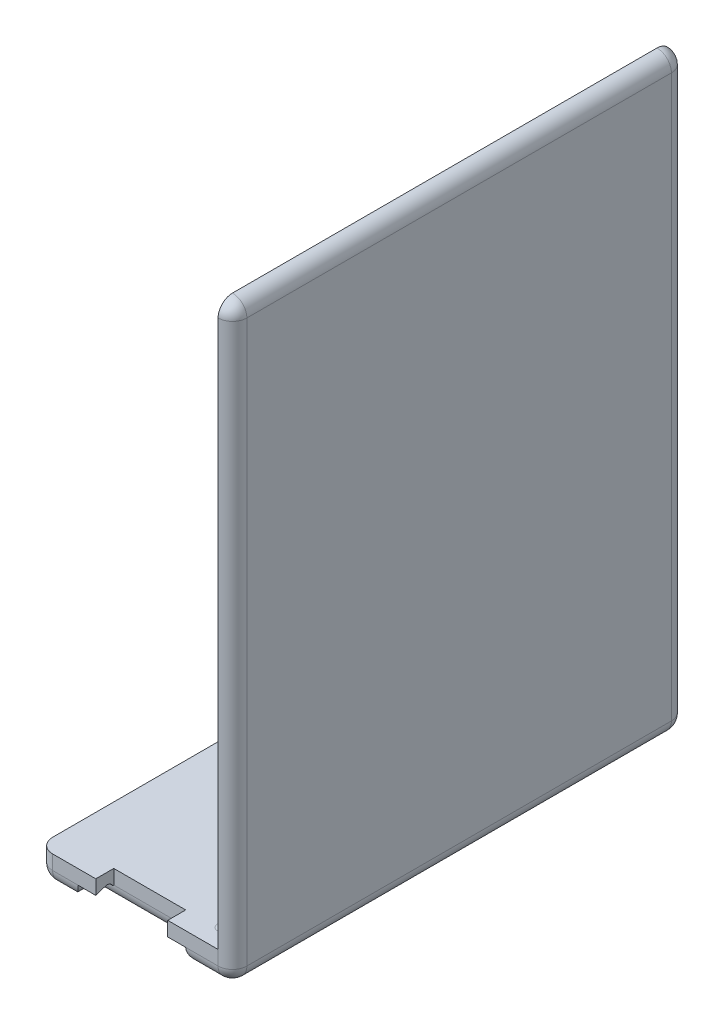
from build123d import *

# Parameters (mm, degrees)
SKETCH1_W           = 25
SKETCH1_H           = 63
BOSS_EXTRUDE1_DEPTH = 4
SKETCH3_W           = 63
SKETCH3_H           = 4
BOSS_EXTRUDE2_DEPTH = 2
SKETCH4_W           = 2
SKETCH4_H           = 63
BOSS_EXTRUDE3_DEPTH = 78
SKETCH6_W           = 10
SKETCH6_H           = 2.5
CUT_EXTRUDE1_DEPTH  = 107.386089316
SKETCH6_3_W         = 10
SKETCH6_3_H         = 2.5
CUT_EXTRUDE2_DEPTH  = 80
SKETCH8_W           = 15
SKETCH8_H           = 2
CUT_EXTRUDE3_DEPTH  = 2.5
CUT_EXTRUDE5_DEPTH  = 15
SKETCH11_W          = 15
SKETCH11_H          = 2
CUT_EXTRUDE6_DEPTH  = 3
CUT_EXTRUDE7_DEPTH  = 15
FILLET6_R           = 2
FILLET7_R           = 2
BOSS_EXTRUDE4_DEPTH = 73
FILLET8_R           = 0.4
FILLET9_R           = 2
CUT_EXTRUDE8_DEPTH  = 2


# Some blends are built 0.0001 mm under size
with BuildPart() as part:
    # Sketch1 → Boss-Extrude1 (new body)
    with BuildSketch(Plane(origin=(0, 0, 0), x_dir=(1, 0, 0), z_dir=(0, 1, 0))):
        with Locations((-12.5, -31.5)):
            Rectangle(SKETCH1_W, SKETCH1_H)
    extrude(amount=BOSS_EXTRUDE1_DEPTH)

    # Sketch3 → Boss-Extrude2 (add)
    with BuildSketch(Plane(origin=(0, 0, 0), x_dir=(0, 0, -1), z_dir=(1, 0, 0))):
        with Locations((-31.5, 2)):
            Rectangle(SKETCH3_W, SKETCH3_H)
    extrude(amount=BOSS_EXTRUDE2_DEPTH)

    # Sketch4 → Boss-Extrude3 (add)
    with BuildSketch(Plane(origin=(0, 4, 0), x_dir=(1, 0, 0), z_dir=(0, 1, 0))):
        with Locations((1, -31.5)):
            Rectangle(SKETCH4_W, SKETCH4_H)
    extrude(amount=BOSS_EXTRUDE3_DEPTH)

    # Sketch6 → Cut-Extrude1 (cut, through all)
    with BuildSketch(Plane.XZ):
        with Locations((-12, 1.25)):
            Rectangle(SKETCH6_W, SKETCH6_H)
    extrude(amount=-CUT_EXTRUDE1_DEPTH, mode=Mode.SUBTRACT)

    # Sketch6<3> → Cut-Extrude2 (cut)
    with BuildSketch(Plane.XZ):
        with Locations((-12, 61.75)):
            Rectangle(SKETCH6_3_W, SKETCH6_3_H)
    extrude(amount=-CUT_EXTRUDE2_DEPTH, mode=Mode.SUBTRACT)

    # Sketch8 → Cut-Extrude3 (cut)
    with BuildSketch(Plane.XY.offset(63)):
        with Locations((-12, 1)):
            Rectangle(SKETCH8_W, SKETCH8_H)
    extrude(amount=-CUT_EXTRUDE3_DEPTH, mode=Mode.SUBTRACT)

    # Sketch9 → Cut-Extrude5 (cut)
    with BuildSketch(Plane.ZY.offset(4.5)):
        with BuildLine():
            ThreePointArc((61.5, 2.5), (61, 2.366025404), (60.633974596, 2))
            Line((60.633974596, 2), (63, 2))
            Line((63, 2), (61.5, 2.5))
        make_face()
    extrude(amount=CUT_EXTRUDE5_DEPTH, mode=Mode.SUBTRACT)

    # Sketch11 → Cut-Extrude6 (cut)
    with BuildSketch(Plane(origin=(0, 0, 0), x_dir=(-1, 0, 0), z_dir=(0, 0, -1))):
        with Locations((12, 1)):
            Rectangle(SKETCH11_W, SKETCH11_H)
    extrude(amount=-CUT_EXTRUDE6_DEPTH, mode=Mode.SUBTRACT)

    # Sketch12 → Cut-Extrude7 (cut)
    with BuildSketch(Plane.ZY.offset(4.5)):
        with BuildLine():
            ThreePointArc((2.766025404, 2), (2.4, 2.366025404), (1.9, 2.5))
            Line((1.9, 2.5), (0, 2))
            Line((0, 2), (2.766025404, 2))
        make_face()
    extrude(amount=CUT_EXTRUDE7_DEPTH, mode=Mode.SUBTRACT)

    # Fillet6
    fillet6_edges = [part.edges().sort_by_distance(p)[0] for p in [
        (-22.25, 0, 0),
        (-12, 0, 3),
        (-19.5, 0, 1.5),
        (-4.5, 0, 1.5),
        (2, 0, 31.5),
        (-22.25, 0, 63),
        (-25, 0, 31.5),
        (-1.25, 0, 0),
        (-12, 0, 60.5),
        (-1.25, 0, 63),
        (-4.5, 0, 61.75),
        (-19.5, 0, 61.75),
    ]]
    fillet(fillet6_edges, radius=FILLET6_R - 0.0001)  # a hair under: the kernel refuses the full size

    # Fillet7
    # the kernel refuses this fillet: 2 mm, written as the material it takes off along each edge
    with BuildSketch(Plane(origin=(-23, 0, 61), x_dir=(0, 0, 1), z_dir=(1, 0, 0))) as fillet7_piece_1:
        with BuildLine():
            CenterArc((0.0001, -1.9999), 1.9999, 0, 90)
            Line((2, -1.9999), (2, 0))
            Line((2, 0), (0.0001, 0))
        make_face()
    revolve(axis=Axis((-23, 0, 61), (0, -1, 0)), revolution_arc=90, mode=Mode.SUBTRACT)
    with BuildSketch(Plane(origin=(-23, 0, 2), x_dir=(-1, 0, 0), z_dir=(0, 0, 1))) as fillet7_piece_2:
        with BuildLine():
            CenterArc((0.0001, -1.9999), 1.9999, 0, 90)
            Line((2, -1.9999), (2, 0))
            Line((2, 0), (0.0001, 0))
        make_face()
    revolve(axis=Axis((-23, 0, 2), (0, -1, 0)), revolution_arc=90, mode=Mode.SUBTRACT)
    with BuildSketch(Plane(origin=(-25, 0, 63), x_dir=(0, 0, -1), z_dir=(0, 1, 0)), Plane(origin=(-25, 0, 0), x_dir=(1, 0, 0), z_dir=(0, 1, 0))) as fillet7_piece_3:
        with BuildLine():
            CenterArc((FILLET7_R, -FILLET7_R), FILLET7_R, 90, 90)
            Line((0, -FILLET7_R), (0, 0))
            Line((0, 0), (FILLET7_R, 0))
        make_face()
    extrude(amount=9, mode=Mode.SUBTRACT)

    # Sketch13 → Boss-Extrude4 (add)
    with BuildSketch(Plane(origin=(0, 4, 0), x_dir=(1, 0, 0), z_dir=(0, 1, 0))):
        Polygon((0, -4.25), (-1.5, -4.25), (-1.5, -2.6), (-2.7, -2.6), (-2.7, -5.6), (0, -5.6), align=None)
        Polygon((-1.5, -60.4), (-2.7, -60.4), (-2.7, -57.4), (0, -57.4), (0, -58.75), (-1.5, -58.75), align=None)
    extrude(amount=BOSS_EXTRUDE4_DEPTH)

    # Fillet8
    fillet8_edges = [part.edges().sort_by_distance(p)[0] for p in [
        (0, 40.5, 5.6),
        (-1.5, 4, 3.425),
        (-2.1, 4, 2.6),
        (-1.5, 40.5, 2.6),
        (-2.7, 4, 4.1),
        (-2.7, 40.5, 2.6),
        (-1.35, 4, 5.6),
        (-2.7, 40.5, 5.6),
        (0, 77, 4.925),
        (-2.1, 77, 2.6),
        (-2.7, 77, 4.1),
        (-1.35, 77, 5.6),
        (-1.5, 4, 59.575),
        (-1.5, 40.5, 60.4),
        (-1.35, 4, 57.4),
        (0, 40.5, 57.4),
        (-2.7, 4, 58.9),
        (-2.7, 40.5, 57.4),
        (-2.1, 4, 60.4),
        (-2.7, 40.5, 60.4),
        (0, 77, 58.075),
        (-1.35, 77, 57.4),
        (-2.7, 77, 58.9),
        (-2.1, 77, 60.4),
    ]]
    fillet(fillet8_edges, radius=FILLET8_R)

    # Fillet9
    # the kernel refuses this fillet: 2 mm, written as the material it takes off along each edge
    with BuildSketch(Plane(origin=(0, 0, 61), x_dir=(1, 0, 0), z_dir=(0, 0, -1))) as fillet9_piece_1:
        with BuildLine():
            CenterArc((0.0001, -1.9999), 1.9999, 0, 90)
            Line((2, -1.9999), (2, 0))
            Line((2, 0), (0.0001, 0))
        make_face()
    revolve(axis=Axis((0, 0, 61), (0, -1, 0)), revolution_arc=90, mode=Mode.SUBTRACT)
    with BuildSketch(Plane(origin=(0, 0, 2), x_dir=(0, 0, -1), z_dir=(-1, 0, 0))) as fillet9_piece_2:
        with BuildLine():
            CenterArc((0.0001, -1.9999), 1.9999, 0, 90)
            Line((2, -1.9999), (2, 0))
            Line((2, 0), (0.0001, 0))
        make_face()
    revolve(axis=Axis((0, 0, 2), (0, -1, 0)), revolution_arc=90, mode=Mode.SUBTRACT)
    with BuildSketch(Plane(origin=(0, 80, 61), x_dir=(0, 0, 1), z_dir=(1, 0, 0))) as fillet9_piece_3_section:
        Polygon((0, 0), (FILLET9_R, 0), (FILLET9_R, -FILLET9_R), (0, -FILLET9_R), align=None)
    fillet9_piece_3 = extrude(amount=FILLET9_R, mode=Mode.PRIVATE)
    fillet9_piece_3 = fillet9_piece_3 - Plane(origin=(0, 80, 61), x_dir=(0, -0.7071067811865475, -0.7071067811865475), z_dir=(1, 0, 0)) * Sphere(FILLET9_R, mode=Mode.PRIVATE)
    add(fillet9_piece_3, mode=Mode.SUBTRACT)
    with BuildSketch(Plane(origin=(0, 80, 2), x_dir=(0, 0, -1), z_dir=(0, 1, 0))) as fillet9_piece_4_section:
        Polygon((0, 0), (FILLET9_R, 0), (FILLET9_R, -FILLET9_R), (0, -FILLET9_R), align=None)
    fillet9_piece_4 = extrude(amount=FILLET9_R, mode=Mode.PRIVATE)
    fillet9_piece_4 = fillet9_piece_4 - Plane(origin=(0, 80, 2), x_dir=(-0.7071067811865474, 0, 0.7071067811865476), z_dir=(0, 1, 0)) * Sphere(FILLET9_R, mode=Mode.PRIVATE)
    add(fillet9_piece_4, mode=Mode.SUBTRACT)
    with BuildSketch(Plane(origin=(2, 80, 63), x_dir=(-1, 0, 0), z_dir=(0, -1, 0)), Plane(origin=(2, 80, 0), x_dir=(0, 0, 1), z_dir=(0, -1, 0))) as fillet9_piece_5:
        with BuildLine():
            CenterArc((FILLET9_R, FILLET9_R), FILLET9_R, 180, 90)
            Line((0, FILLET9_R), (0, 0))
            Line((0, 0), (FILLET9_R, 0))
        make_face()
    extrude(amount=80, mode=Mode.SUBTRACT)
    with BuildSketch(Plane(origin=(2, 82, 2), x_dir=(-1, 0, 0), z_dir=(0, 0, 1))) as fillet9_piece_6:
        with BuildLine():
            CenterArc((FILLET9_R, FILLET9_R), FILLET9_R, 180, 90)
            Line((0, FILLET9_R), (0, 0))
            Line((0, 0), (FILLET9_R, 0))
        make_face()
    extrude(amount=59, mode=Mode.SUBTRACT)
    with BuildSketch(Plane(origin=(-5, 82, 0), x_dir=(0, 0, 1), z_dir=(1, 0, 0))) as fillet9_piece_7:
        with BuildLine():
            CenterArc((FILLET9_R, FILLET9_R), FILLET9_R, 180, 90)
            Line((0, FILLET9_R), (0, 0))
            Line((0, 0), (FILLET9_R, 0))
        make_face()
    extrude(amount=5, mode=Mode.SUBTRACT)
    with BuildSketch(Plane(origin=(0, 82, 63), x_dir=(0, -1, 0), z_dir=(-1, 0, 0))) as fillet9_piece_8:
        with BuildLine():
            CenterArc((FILLET9_R, -FILLET9_R), FILLET9_R, 90, 90)
            Line((0, -FILLET9_R), (0, 0))
            Line((0, 0), (FILLET9_R, 0))
        make_face()
    extrude(amount=5, mode=Mode.SUBTRACT)

    # Sketch14 → Cut-Extrude8 (cut)
    # profile 1 of 4: a face of its own
    with BuildSketch(Plane.XZ):
        with BuildLine():
            Line((-5.919248632, 49.823076923), (-5.919248632, 47.281550481))
            add(Edge.make_bspline(
                [(-5.919248632, 47.281550481), (-5.919813187, 47.111946957), (-5.920897195, 46.786289405), (-5.926941534, 46.319752109), (-5.944265625, 45.895836643), (-5.959173914, 45.514764655), (-5.986358958, 45.176543135), (-6.012341878, 44.880134966), (-6.046354875, 44.626905321), (-6.077943124, 44.473613232), (-6.092245427, 44.404206731)],
                knots=[0, 0, 0, 0, 1.410062039, 2.707475311, 3.878576406, 4.937260626, 5.877586885, 6.699081471, 7.410979367, 8, 8, 8, 8], degree=3))
            add(Edge.make_bspline(
                [(-6.092245427, 44.404206731), (-6.115199943, 44.311289629), (-6.160619292, 44.127437601), (-6.256667626, 43.862756819), (-6.367633727, 43.61043153), (-6.498979152, 43.371408638), (-6.648412954, 43.145665968), (-6.816808221, 42.933541518), (-7.005022526, 42.736248065), (-7.208249667, 42.552267532), (-7.428262862, 42.385495099), (-7.661857116, 42.24117538), (-7.907571433, 42.117595128), (-8.166261481, 42.018937297), (-8.435740462, 41.939570096), (-8.718361433, 41.883589759), (-9.01286096, 41.850022581), (-9.21373093, 41.846604795), (-9.315582767, 41.844871795)],
                knots=[0, 0, 0, 0, 1.02737288, 2.032829108, 3.019628684, 3.985738875, 4.958353778, 5.924249254, 6.890702889, 7.883913451, 8.865824512, 9.85161466, 10.829249435, 11.81541824, 12.821369441, 13.843154991, 14.906364023, 16, 16, 16, 16], degree=3))
            add(Edge.make_bspline(
                [(-9.315582767, 41.844871795), (-9.484801769, 41.850202021), (-9.814991873, 41.860602673), (-10.294181494, 41.957578553), (-10.741192668, 42.116417716), (-11.15540331, 42.335331111), (-11.528957554, 42.613979721), (-11.855952698, 42.948851986), (-12.132114996, 43.338237737), (-12.321586672, 43.702432207), (-12.443500869, 44.024295143), (-12.529710764, 44.290050517), (-12.595195508, 44.580164832), (-12.654711991, 44.890475958), (-12.700127848, 45.223380769), (-12.732381739, 45.578208877), (-12.753121236, 45.955847728), (-12.756151365, 46.214709149), (-12.75771017, 46.347876603)],
                knots=[0, 0, 0, 0, 1.260402266, 2.459371274, 3.627181936, 4.786749125, 5.93865593, 7.087644312, 8.261344208, 9.485713728, 10.136162886, 10.825977872, 11.566646758, 12.35154167, 13.181268117, 14.0701832, 15.007234106, 16, 16, 16, 16], degree=3))
            Line((-12.75771017, 46.347876603), (-18.619248632, 41.682051282))
            Line((-18.619248632, 41.682051282), (-18.619248632, 43.091466346))
            Line((-18.619248632, 43.091466346), (-12.75771017, 47.757291667))
            Line((-12.75771017, 47.757291667), (-12.75771017, 48.683333333))
            Line((-12.75771017, 48.683333333), (-18.619248632, 48.683333333))
            Line((-18.619248632, 48.683333333), (-18.619248632, 49.823076923))
            Line((-18.619248632, 49.823076923), (-5.919248632, 49.823076923))
        make_face()
        with BuildLine():
            Line((-7.221812735, 48.683333333), (-11.455146068, 48.683333333))
            Line((-11.455146068, 48.683333333), (-11.472954561, 46.358052885))
            add(Edge.make_bspline(
                [(-11.472954561, 46.358052885), (-11.473002591, 46.249485887), (-11.473095687, 46.039052123), (-11.458603989, 45.734612562), (-11.442118218, 45.451148177), (-11.416902075, 45.189743093), (-11.384404154, 44.950280919), (-11.343753897, 44.732880076), (-11.296391692, 44.537189825), (-11.223096498, 44.308947778), (-11.106907323, 44.054158507), (-10.938149165, 43.776913722), (-10.724514754, 43.541618379), (-10.484109685, 43.338748188), (-10.214353024, 43.182486472), (-9.927218253, 43.068755358), (-9.6251843, 42.997382747), (-9.417732181, 42.988897552), (-9.313038696, 42.984615385)],
                knots=[0, 0, 0, 0, 1.14660753, 2.222451964, 3.218720504, 4.145691244, 4.995719623, 5.770487122, 6.480909919, 7.121111896, 8.299844659, 9.430703709, 10.534634535, 11.641396424, 12.741395289, 13.810956493, 14.895269934, 16, 16, 16, 16], degree=3))
            add(Edge.make_bspline(
                [(-9.313038696, 42.984615385), (-9.21087852, 42.988910715), (-9.008434329, 42.997422491), (-8.712874717, 43.068893645), (-8.431925819, 43.184309109), (-8.17094271, 43.346148301), (-7.932066625, 43.541706141), (-7.730503412, 43.773960156), (-7.561705968, 44.031213747), (-7.454626305, 44.271825125), (-7.388845567, 44.48673872), (-7.342613343, 44.673363792), (-7.30515615, 44.885035672), (-7.27603389, 45.121247078), (-7.249827183, 45.381570666), (-7.232835449, 45.66671925), (-7.222565642, 45.976363548), (-7.222069544, 46.190983324), (-7.221812735, 46.302083333)],
                knots=[0, 0, 0, 0, 1.100801541, 2.181386982, 3.260112282, 4.364594493, 5.481957178, 6.577424609, 7.668452592, 8.790448866, 9.403819393, 10.091598921, 10.863153553, 11.720938239, 12.658472417, 13.685008818, 14.801622349, 16, 16, 16, 16], degree=3))
            Line((-7.221812735, 46.302083333), (-7.221812735, 48.683333333))
        make_face(mode=Mode.SUBTRACT)
    # profile 2 of 4: a face of its own
    with BuildSketch(Plane.XZ):
        Polygon((-5.919248632, 39.076923077), (-5.919248632, 31.912820513), (-7.221812735, 31.912820513), (-7.221812735, 37.937179487), (-11.129505042, 37.937179487), (-11.129505042, 31.912820513), (-12.432069145, 31.912820513), (-12.432069145, 37.937179487), (-17.316684529, 37.937179487), (-17.316684529, 31.912820513), (-18.619248632, 31.912820513), (-18.619248632, 39.076923077), align=None)
    # profile 3 of 4: a face of its own
    with BuildSketch(Plane.XZ):
        with BuildLine():
            Line((-16.169308728, 30.935897436), (-15.525658888, 29.862299679))
            add(Edge.make_bspline(
                [(-15.525658888, 29.862299679), (-15.692806799, 29.76244779), (-16.013055747, 29.571135423), (-16.445792065, 29.251997634), (-16.813591891, 28.921315357), (-17.114315581, 28.576639775), (-17.351075827, 28.220074763), (-17.518723925, 27.849292625), (-17.62328475, 27.465542855), (-17.635985064, 27.204380703), (-17.642325555, 27.073998397)],
                knots=[0, 0, 0, 0, 1.272034388, 2.437168799, 3.508375237, 4.49857839, 5.41946034, 6.295179144, 7.148887113, 8, 8, 8, 8], degree=3))
            add(Edge.make_bspline(
                [(-17.642325555, 27.073998397), (-17.639224319, 26.962648921), (-17.63307611, 26.741898321), (-17.574, 26.416915494), (-17.483241919, 26.101295176), (-17.353262306, 25.801546211), (-17.196008419, 25.521790677), (-17.006056371, 25.276505142), (-16.793435776, 25.064322122), (-16.556058458, 24.891232932), (-16.301648745, 24.756862672), (-16.038173237, 24.659628634), (-15.766790876, 24.597745017), (-15.582801827, 24.589868474), (-15.490041901, 24.585897436)],
                knots=[0, 0, 0, 0, 1.095270387, 2.171376115, 3.241375676, 4.322296363, 5.380636668, 6.392615365, 7.366724986, 8.328592944, 9.273498763, 10.190095884, 11.087518669, 12, 12, 12, 12], degree=3))
            add(Edge.make_bspline(
                [(-15.490041901, 24.585897436), (-15.384302247, 24.591247078), (-15.16934898, 24.602122117), (-14.852213097, 24.694039202), (-14.538368628, 24.838635041), (-14.344235465, 24.972030919), (-14.24344735, 25.041286058)],
                knots=[0, 0, 0, 0, 0.938893495, 1.908633276, 2.914225137, 4, 4, 4, 4], degree=3))
            add(Edge.make_bspline(
                [(-14.24344735, 25.041286058), (-14.170557318, 25.097987026), (-14.017084632, 25.217373033), (-13.792456211, 25.425459585), (-13.555090155, 25.663282403), (-13.305950351, 25.932030428), (-13.049586712, 26.23704581), (-12.780655314, 26.572065432), (-12.499964396, 26.93882355), (-12.314346233, 27.197298098), (-12.218367222, 27.330949519)],
                knots=[0, 0, 0, 0, 0.72226686, 1.520759855, 2.393439377, 3.351307446, 4.386958158, 5.510256019, 6.712608938, 8, 8, 8, 8], degree=3))
            add(Edge.make_bspline(
                [(-12.218367222, 27.330949519), (-12.123173134, 27.464550196), (-11.941169288, 27.719984517), (-11.671397078, 28.077478937), (-11.423176838, 28.396729033), (-11.199966184, 28.679361544), (-10.992029798, 28.918064408), (-10.810511909, 29.121563936), (-10.645719669, 29.28235226), (-10.538901892, 29.37182717), (-10.490943343, 29.411999199)],
                knots=[0, 0, 0, 0, 1.452255772, 2.776602448, 3.96446981, 5.032613149, 5.964194703, 6.766668629, 7.446264616, 8, 8, 8, 8], degree=3))
            add(Edge.make_bspline(
                [(-10.490943343, 29.411999199), (-10.41619101, 29.468142434), (-10.269180513, 29.578555642), (-10.039401744, 29.724300862), (-9.804185895, 29.848177252), (-9.562900901, 29.945286286), (-9.318934159, 30.027060566), (-9.069102496, 30.0820622), (-8.814526937, 30.116502412), (-8.643209378, 30.120029334), (-8.557449754, 30.121794872)],
                knots=[0, 0, 0, 0, 1.068054152, 2.10047183, 3.106115577, 4.101338837, 5.06977816, 6.043150881, 7.020423561, 8, 8, 8, 8], degree=3))
            add(Edge.make_bspline(
                [(-8.557449754, 30.121794872), (-8.423073322, 30.117079487), (-8.157192659, 30.107749505), (-7.76898687, 30.028199893), (-7.397222937, 29.904107756), (-7.050089686, 29.724634193), (-6.728398892, 29.502738415), (-6.437065465, 29.240492462), (-6.190065235, 28.929133116), (-5.976759062, 28.585606884), (-5.808344919, 28.212017527), (-5.680627929, 27.821242217), (-5.609226311, 27.411567391), (-5.598864996, 27.133620139), (-5.593607606, 26.992588141)],
                knots=[0, 0, 0, 0, 1.005541892, 1.989591032, 2.955705311, 3.932863626, 4.905387107, 5.876519979, 6.856563935, 7.871847665, 8.897921447, 9.918317993, 10.943742853, 12, 12, 12, 12], degree=3))
            add(Edge.make_bspline(
                [(-5.593607606, 26.992588141), (-5.598672742, 26.842908669), (-5.608717511, 26.546076377), (-5.699181484, 26.108630149), (-5.845309441, 25.686649893), (-6.013613405, 25.346976464), (-6.180955469, 25.081593178), (-6.33343827, 24.879221341), (-6.508967579, 24.674142692), (-6.708029226, 24.464708915), (-6.932444299, 24.254467003), (-7.180677452, 24.040296217), (-7.451211217, 23.821695577), (-7.644340123, 23.681067171), (-7.74334719, 23.608974359)],
                knots=[0, 0, 0, 0, 1.286821612, 2.551921131, 3.825787379, 5.12137259, 5.803616487, 6.523126609, 7.299589446, 8.125436757, 9.008162487, 9.944516264, 10.946261234, 12, 12, 12, 12], degree=3))
            Line((-7.74334719, 23.608974359), (-8.524376837, 24.639322917))
            add(Edge.make_bspline(
                [(-8.524376837, 24.639322917), (-8.444226444, 24.701538157), (-8.289875526, 24.821350162), (-8.073716782, 25.003248596), (-7.876262599, 25.174693657), (-7.704758038, 25.343605214), (-7.549809213, 25.50106176), (-7.417153086, 25.65388759), (-7.305470071, 25.799877124), (-7.186343158, 25.983922433), (-7.067505249, 26.215735759), (-6.969087171, 26.50644149), (-6.90781506, 26.809409369), (-6.900095489, 27.015193601), (-6.896171709, 27.119791667)],
                knots=[0, 0, 0, 0, 1.181667846, 2.275615987, 3.290305621, 4.226321945, 5.078535498, 5.862783384, 6.581873284, 7.217493746, 8.414623899, 9.604724551, 10.782505457, 12, 12, 12, 12], degree=3))
            add(Edge.make_bspline(
                [(-6.896171709, 27.119791667), (-6.900568449, 27.250988191), (-6.909047147, 27.503988329), (-7.001648237, 27.863181471), (-7.147450987, 28.186465142), (-7.351793908, 28.464241592), (-7.593895795, 28.695515766), (-7.872493355, 28.862812717), (-8.180132359, 28.963506171), (-8.394732083, 28.975793528), (-8.504024273, 28.982051282)],
                knots=[0, 0, 0, 0, 1.14458467, 2.207223713, 3.21896685, 4.227309161, 5.202851033, 6.127160689, 7.046193047, 8, 8, 8, 8], degree=3))
            add(Edge.make_bspline(
                [(-8.504024273, 28.982051282), (-8.572048005, 28.980558386), (-8.708206701, 28.977570152), (-8.90989953, 28.938704983), (-9.109802001, 28.883595341), (-9.308802999, 28.802938986), (-9.511584175, 28.694298498), (-9.717598044, 28.546580093), (-9.932045961, 28.361778288), (-10.071383651, 28.21993897), (-10.144949754, 28.145052083)],
                knots=[0, 0, 0, 0, 0.858526328, 1.718456515, 2.587092892, 3.476767204, 4.426280253, 5.487868114, 6.673670035, 8, 8, 8, 8], degree=3))
            add(Edge.make_bspline(
                [(-10.144949754, 28.145052083), (-10.16975839, 28.117252246), (-10.228698032, 28.051206197), (-10.325190022, 27.930462124), (-10.444217224, 27.771012541), (-10.591491201, 27.577021126), (-10.762329649, 27.344910985), (-10.954548185, 27.074656595), (-11.17438685, 26.769270462), (-11.328084212, 26.552565224), (-11.409352799, 26.437980769)],
                knots=[0, 0, 0, 0, 0.420754252, 0.999615792, 1.744751191, 2.668019286, 3.750313428, 4.999500688, 6.413464383, 8, 8, 8, 8], degree=3))
            add(Edge.make_bspline(
                [(-11.409352799, 26.437980769), (-11.509651446, 26.30014617), (-11.703865876, 26.033248571), (-11.995659915, 25.653491066), (-12.281038961, 25.309162106), (-12.558180564, 24.999052767), (-12.824982501, 24.720099413), (-13.084654613, 24.475396827), (-13.335336548, 24.262451644), (-13.656728465, 24.033201337), (-14.0514484, 23.798948678), (-14.535058008, 23.597775208), (-15.020547514, 23.470926347), (-15.346853463, 23.454338277), (-15.507850395, 23.446153846)],
                knots=[0, 0, 0, 0, 1.163667725, 2.253281268, 3.268753668, 4.215851969, 5.092017293, 5.902905408, 6.650798638, 7.335211899, 8.59617414, 9.77448103, 10.901945474, 12, 12, 12, 12], degree=3))
            add(Edge.make_bspline(
                [(-15.507850395, 23.446153846), (-15.621708136, 23.448539643), (-15.847212579, 23.453264907), (-16.178351196, 23.507532389), (-16.499906093, 23.587141098), (-16.808193931, 23.706750773), (-17.107339854, 23.853881971), (-17.394588306, 24.03561012), (-17.66599052, 24.254683286), (-17.927194347, 24.498174237), (-18.163136497, 24.768773613), (-18.374160326, 25.054094759), (-18.550785944, 25.35599001), (-18.692970023, 25.672998161), (-18.805936009, 26.003365585), (-18.8871336, 26.34743996), (-18.937082206, 26.706179427), (-18.94225812, 26.950023324), (-18.944889658, 27.073998397)],
                knots=[0, 0, 0, 0, 0.983610584, 1.948120116, 2.894308362, 3.843560551, 4.801159957, 5.773581695, 6.77566113, 7.813174769, 8.857584665, 9.875476876, 10.877851407, 11.875574773, 12.875048225, 13.892438445, 14.928473903, 16, 16, 16, 16], degree=3))
            add(Edge.make_bspline(
                [(-18.944889658, 27.073998397), (-18.943013545, 27.169916694), (-18.939284948, 27.360545296), (-18.90710267, 27.641751227), (-18.859906969, 27.917793363), (-18.78795062, 28.185205664), (-18.698592262, 28.447317898), (-18.589185881, 28.701793677), (-18.458943147, 28.949251262), (-18.307648334, 29.189979616), (-18.133286393, 29.426247091), (-17.931785769, 29.656842412), (-17.704538267, 29.884403611), (-17.449213411, 30.104759139), (-17.168539086, 30.321970723), (-16.860163516, 30.531998924), (-16.525687498, 30.739120533), (-16.290320454, 30.869080009), (-16.169308728, 30.935897436)],
                knots=[0, 0, 0, 0, 0.915384692, 1.819241058, 2.699029451, 3.586605375, 4.459625921, 5.340865773, 6.228072412, 7.126546901, 8.052715223, 9.028303326, 10.047266019, 11.120332924, 12.245748783, 13.433636234, 14.680528497, 16, 16, 16, 16], degree=3))
        make_face()
    # profile 4 of 4: a face of its own
    with BuildSketch(Plane.XZ):
        with BuildLine():
            Line((-5.919248632, 20.841025641), (-5.919248632, 18.350380609))
            add(Edge.make_bspline(
                [(-5.919248632, 18.350380609), (-5.919436941, 18.179072464), (-5.91979775, 17.85083845), (-5.930736971, 17.380158105), (-5.94534811, 16.952677079), (-5.965602409, 16.569317125), (-5.989538607, 16.228898712), (-6.023110293, 15.932962225), (-6.058163366, 15.679181549), (-6.093801041, 15.527121004), (-6.11005392, 15.457772436)],
                knots=[0, 0, 0, 0, 1.415646017, 2.712440637, 3.8905458, 4.950247383, 5.884950622, 6.709939814, 7.411656543, 8, 8, 8, 8], degree=3))
            add(Edge.make_bspline(
                [(-6.11005392, 15.457772436), (-6.134081924, 15.369984263), (-6.181571741, 15.196476536), (-6.276693211, 14.946467178), (-6.389465554, 14.708589237), (-6.518046415, 14.482093016), (-6.667696671, 14.26951676), (-6.833682458, 14.068139353), (-7.015912456, 13.87680575), (-7.217919327, 13.702015496), (-7.432255137, 13.541098627), (-7.663693262, 13.403056364), (-7.907196539, 13.286290833), (-8.16525874, 13.190928958), (-8.43631143, 13.118417148), (-8.721145898, 13.064843133), (-9.018783427, 13.030565814), (-9.222204996, 13.027302336), (-9.325759049, 13.025641026)],
                knots=[0, 0, 0, 0, 0.999487232, 1.975422798, 2.933948774, 3.889618007, 4.832992075, 5.786114792, 6.754729845, 7.731954186, 8.717668599, 9.695514499, 10.68728626, 11.680675814, 12.71351902, 13.766008651, 14.862761406, 16, 16, 16, 16], degree=3))
            add(Edge.make_bspline(
                [(-9.325759049, 13.025641026), (-9.430181267, 13.027170195), (-9.634490391, 13.030162119), (-9.933385936, 13.066071497), (-10.219021238, 13.11444105), (-10.490762958, 13.188816068), (-10.746997325, 13.286227511), (-10.991640081, 13.400498674), (-11.220529177, 13.538324627), (-11.434495574, 13.696693009), (-11.633740113, 13.872865937), (-11.816818939, 14.066098027), (-11.982660396, 14.275609174), (-12.131636271, 14.50073354), (-12.260291914, 14.743665849), (-12.375525563, 15.000721663), (-12.472303412, 15.274135306), (-12.523212492, 15.463338142), (-12.549096388, 15.559535256)],
                knots=[0, 0, 0, 0, 1.121902311, 2.195077645, 3.232258892, 4.234102512, 5.217864754, 6.176164875, 7.132989551, 8.084763148, 9.034132444, 9.988522005, 10.94243251, 11.903244335, 12.886203696, 13.894208494, 14.929344452, 16, 16, 16, 16], degree=3))
            add(Edge.make_bspline(
                [(-12.549096388, 15.559535256), (-12.566016348, 15.639100154), (-12.603097424, 15.813471253), (-12.644493825, 16.100646274), (-12.679827404, 16.435002388), (-12.706320104, 16.816083233), (-12.729000012, 17.243546745), (-12.747027096, 17.717624164), (-12.756932565, 18.239246102), (-12.757443442, 18.603087473), (-12.75771017, 18.793048878)],
                knots=[0, 0, 0, 0, 0.601384939, 1.31797006, 2.144135048, 3.087295005, 4.142315834, 5.309527816, 6.595305764, 8, 8, 8, 8], degree=3))
            Line((-12.75771017, 18.793048878), (-12.75771017, 19.701282051))
            Line((-12.75771017, 19.701282051), (-18.619248632, 19.701282051))
            Line((-18.619248632, 19.701282051), (-18.619248632, 20.841025641))
            Line((-18.619248632, 20.841025641), (-5.919248632, 20.841025641))
        make_face()
        with BuildLine():
            Line((-7.221812735, 19.701282051), (-11.455146068, 19.701282051))
            Line((-11.455146068, 19.701282051), (-11.483130843, 17.477764423))
            add(Edge.make_bspline(
                [(-11.483130843, 17.477764423), (-11.483198736, 17.369196773), (-11.483329801, 17.159609164), (-11.468670717, 16.856023539), (-11.452500764, 16.57508866), (-11.427177924, 16.316194436), (-11.393812702, 16.081319352), (-11.357495296, 15.867446518), (-11.308292438, 15.677706919), (-11.239686878, 15.455366852), (-11.124959232, 15.208453103), (-10.954138144, 14.941620548), (-10.742374484, 14.71182333), (-10.501007051, 14.514295369), (-10.231519399, 14.361211723), (-9.94544568, 14.246073303), (-9.642605886, 14.179005835), (-9.435473252, 14.16995589), (-9.33084719, 14.165384615)],
                knots=[0, 0, 0, 0, 1.160368111, 2.240066715, 3.248291599, 4.168343349, 5.019594299, 5.784185847, 6.485545725, 7.113397927, 8.269509094, 9.383373363, 10.487084095, 11.595623793, 12.704274681, 13.786671823, 14.88201193, 16, 16, 16, 16], degree=3))
            add(Edge.make_bspline(
                [(-9.33084719, 14.165384615), (-9.228752518, 14.1699803), (-9.025800947, 14.179115953), (-8.728218096, 14.246602325), (-8.445179511, 14.360986961), (-8.179009589, 14.515332687), (-7.938629955, 14.707188991), (-7.731645475, 14.931893687), (-7.56298947, 15.184858455), (-7.454882755, 15.420291731), (-7.388766039, 15.629283188), (-7.342525635, 15.810832228), (-7.305601087, 16.015811251), (-7.275703967, 16.244294776), (-7.250109824, 16.494509438), (-7.232743611, 16.76860565), (-7.222578313, 17.065544857), (-7.222074106, 17.271686074), (-7.221812735, 17.378545673)],
                knots=[0, 0, 0, 0, 1.120550889, 2.227516482, 3.330715807, 4.461473166, 5.594337325, 6.694900473, 7.802844763, 8.919519911, 9.52614448, 10.208195984, 10.975273469, 11.811520316, 12.738076669, 13.736566072, 14.826679847, 16, 16, 16, 16], degree=3))
            Line((-7.221812735, 17.378545673), (-7.221812735, 19.701282051))
        make_face(mode=Mode.SUBTRACT)
    extrude(amount=-CUT_EXTRUDE8_DEPTH, mode=Mode.SUBTRACT)


solid = part.part
